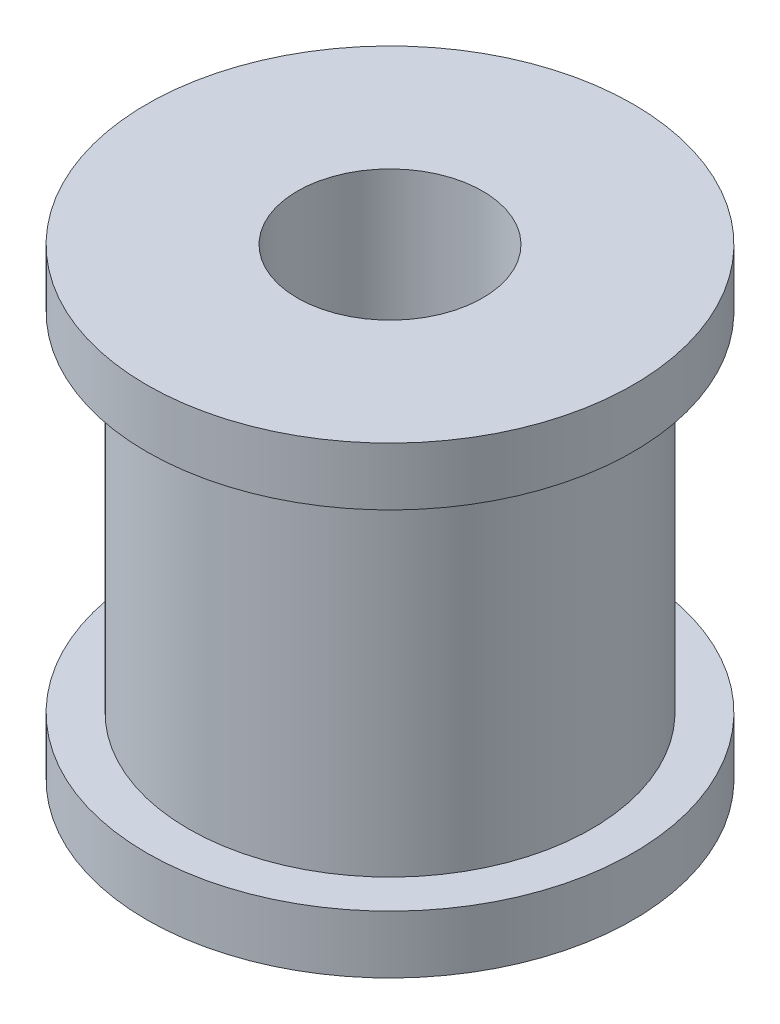
from build123d import *


with BuildPart() as part:
    # Schizzo1 → Rivoluzione1 (revolve)
    with BuildSketch(Plane.XY):
        Polygon((4, -7.661290323), (10.5, -7.661290323), (10.5, -5.161290323), (8.7, -5.161290323), (8.7, 9.838709677), (10.5, 9.838709677), (10.5, 12.338709677), (4, 12.338709677), align=None)
    revolve(axis=Axis((0, 12.338709677, 0), (0, -1, 0)))


solid = part.part
